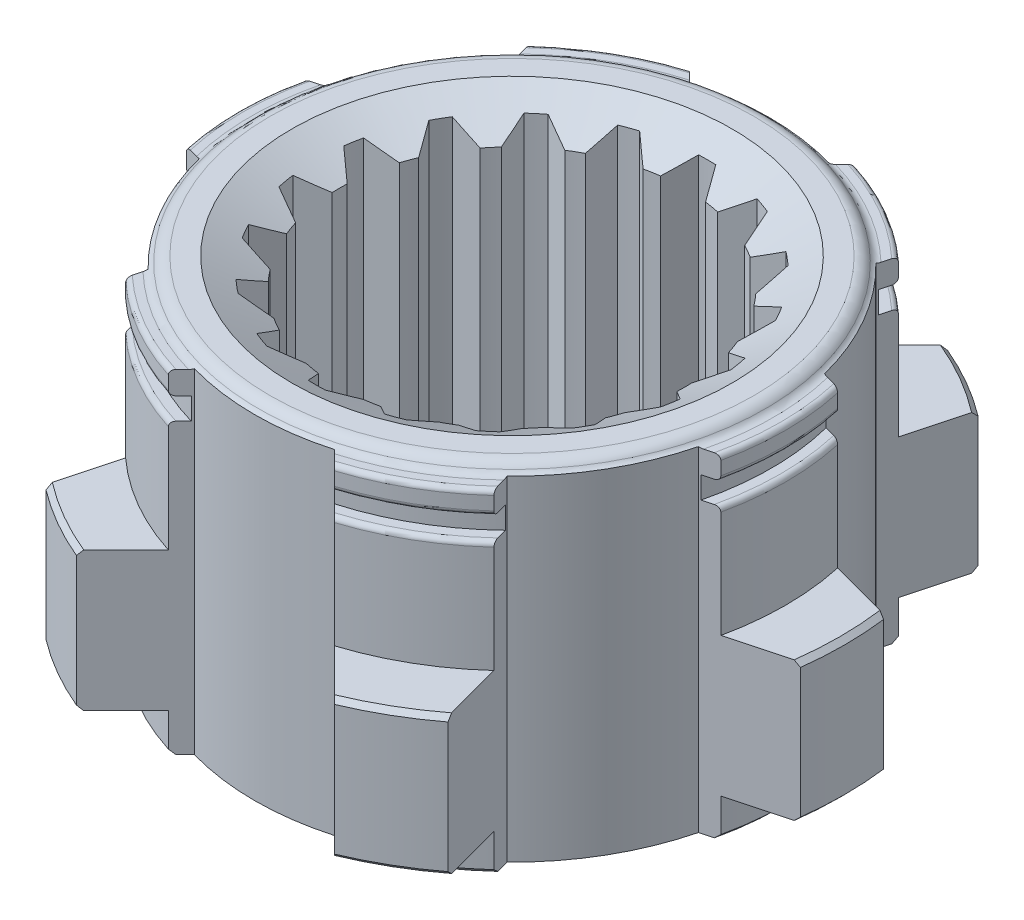
from build123d import *

# Parameters (mm, degrees)
CHANFRO1_SIZE         = 5
CHANFRO1_SIZE2        = 2.886751346
CHANFRO2_SIZE         = 5
CHANFRO2_SIZE2        = 2.886751346
FILETE1_R             = 1.5
FILETE2_R             = 1
FILETE3_R             = 0.5
CHANFRO3_SIZE         = 0.5
CORTE_EXTRUS_O1_DEPTH = 62.090261149
CORTE_EXTRUS_O2_DEPTH = 60.571494523


with BuildPart() as part:
    # Esboço1 → Revolução1 (revolve)
    with BuildSketch(Plane.XY, mode=Mode.PRIVATE) as revolu_o1_sk:
        Polygon((18.1, 26.416366366), (26.8, 26.416366366), (26.8, 25.416366366), (28.7, 25.416366366), (28.7, 23.016366366), (27.2, 23.016366366), (27.2, 20.716366366), (28.7, 20.716366366), (28.7, 9.016366366), (34.9, 9.016366366), (34.9, -5.583633634), (28.7, -5.583633634), (28.7, -9.583633634), (18.1, -9.583633634), align=None)
    revolve(revolu_o1_sk.sketch.rotate(Axis((0, -41.494294294, 0), (0, 1, 0)), 90), axis=Axis((0, -41.494294294, 0), (0, 1, 0)))

    # Chanfro1
    chanfro1_edges = [part.edges().sort_by_distance(p)[0] for p in [
        (0, 26.416366366, 18.1),
    ]]
    chanfro1_side = [part.faces().sort_by_distance(p)[0] for p in [
        (0, 26.416366366, 18.858018469),
    ]]
    chamfer(chanfro1_edges, length=CHANFRO1_SIZE, length2=CHANFRO1_SIZE2, reference=chanfro1_side[0])

    # Chanfro2
    chanfro2_edges = [part.edges().sort_by_distance(p)[0] for p in [
        (0, -9.583633634, 18.1),
    ]]
    chanfro2_side = [part.faces().sort_by_distance(p)[0] for p in [
        (0, -9.583633634, 27.888241415),
    ]]
    chamfer(chanfro2_edges, length=CHANFRO2_SIZE, length2=CHANFRO2_SIZE2, reference=chanfro2_side[0])

    # Filete1
    # the kernel refuses this fillet: 1.5 mm, written as the material it takes off along each edge
    with BuildSketch(Plane(origin=(0, 26.416366366, 0), x_dir=(0, 0, -1), z_dir=(1, 0, 0))) as filete1_piece_1:
        with BuildLine():
            CenterArc((25.385786438, -1.5), FILETE1_R, 19.471220634, 70.528779366)
            Line((26.8, -1), (26.828284271, -0.99))
            ThreePointArc((26.828284271, -0.99), (26.83, -0.5), (26.83, 0))
            Line((26.83, 0), (26.8, 0.03))
            Line((26.8, 0.03), (25.385786438, 0.03))
            Line((25.385786438, 0.03), (25.385786438, 0))
        make_face()
    revolve(axis=Axis((0, 26.416366366, 0), (0, 1, 0)), mode=Mode.SUBTRACT)

    # Filete2
    filete2_edges = [part.edges().sort_by_distance(p)[0] for p in [
        (0, 25.416366366, 26.8),
    ]]
    fillet(filete2_edges, radius=FILETE2_R)

    # Filete3
    filete3_edges = [part.edges().sort_by_distance(p)[0] for p in [
        (0, 20.716366366, 28.7),
        (0, 23.016366366, 28.7),
        (0, 25.416366366, 28.7),
    ]]
    fillet(filete3_edges, radius=FILETE3_R)

    # Chanfro3
    chanfro3_edges = [part.edges().sort_by_distance(p)[0] for p in [
        (0, -5.583633634, 34.9),
        (0, 9.016366366, 34.9),
        (0, -9.583633634, 28.7),
    ]]
    chamfer(chanfro3_edges, length=CHANFRO3_SIZE)

    # Esboço2 → Corte-extrusão1 (cut, through all)
    with BuildSketch(Plane.XZ.offset(9.583633634)):
        with BuildLine():
            Line((-7.35, -25.980329097), (-21.814074716, -40.444403813))
            Line((-21.814074716, -40.444403813), (21.814074716, -40.444403813))
            Line((21.814074716, -40.444403813), (7.35, -25.980329097))
            ThreePointArc((7.35, -25.980329097), (0, -27), (-7.35, -25.980329097))
        make_face()
        with BuildLine():
            Line((-26.174624997, -6.624877831), (-45.932918501, -1.330659043))
            Line((-45.932918501, -1.330659043), (-24.118843785, -39.11374477))
            Line((-24.118843785, -39.11374477), (-18.824624997, -19.355451266))
            ThreePointArc((-18.824624997, -19.355451266), (-23.382685902, -13.5), (-26.174624997, -6.624877831))
        make_face()
        with BuildLine():
            Line((-18.824624997, 19.355451266), (-24.118843785, 39.11374477))
            Line((-24.118843785, 39.11374477), (-45.932918501, 1.330659043))
            Line((-45.932918501, 1.330659043), (-26.174624997, 6.624877831))
            ThreePointArc((-26.174624997, 6.624877831), (-23.382685902, 13.5), (-18.824624997, 19.355451266))
        make_face()
        with BuildLine():
            Line((7.35, 25.980329097), (21.814074716, 40.444403813))
            Line((21.814074716, 40.444403813), (-21.814074716, 40.444403813))
            Line((-21.814074716, 40.444403813), (-7.35, 25.980329097))
            ThreePointArc((-7.35, 25.980329097), (0, 27), (7.35, 25.980329097))
        make_face()
        with BuildLine():
            Line((26.174624997, 6.624877831), (45.932918501, 1.330659043))
            Line((45.932918501, 1.330659043), (24.118843785, 39.11374477))
            Line((24.118843785, 39.11374477), (18.824624997, 19.355451266))
            ThreePointArc((18.824624997, 19.355451266), (23.382685902, 13.5), (26.174624997, 6.624877831))
        make_face()
        with BuildLine():
            Line((18.824624997, -19.355451266), (24.118843785, -39.11374477))
            Line((24.118843785, -39.11374477), (45.932918501, -1.330659043))
            Line((45.932918501, -1.330659043), (26.174624997, -6.624877831))
            ThreePointArc((26.174624997, -6.624877831), (23.382685902, -13.5), (18.824624997, -19.355451266))
        make_face()
    extrude(amount=-CORTE_EXTRUS_O1_DEPTH, mode=Mode.SUBTRACT)

    # Esboço3 → Corte-extrusão2 (cut, through all)
    with BuildSketch(Plane(origin=(0, 26.416366366, 0), x_dir=(1, 0, 0), z_dir=(0, 1, 0))):
        with BuildLine():
            Line((-0.9, 20.480234374), (-2.469708185, 17.761420043))
            Line((-2.469708185, 17.761420043), (2.469708185, 17.761420043))
            Line((2.469708185, 17.761420043), (0.9, 20.480234374))
            ThreePointArc((0.9, 20.480234374), (0, 20.5), (-0.9, 20.480234374))
        make_face()
        with BuildLine():
            Line((6.158929337, 19.552943242), (3.753996872, 17.534965297))
            Line((3.753996872, 17.534965297), (8.395529986, 15.845585402))
            Line((8.395529986, 15.845585402), (7.850376055, 18.937306984))
            ThreePointArc((7.850376055, 18.937306984), (7.011412938, 19.263698726), (6.158929337, 19.552943242))
        make_face()
        with BuildLine():
            Line((12.4750009, 16.267278584), (9.524914503, 15.193534947))
            Line((9.524914503, 15.193534947), (13.308726966, 12.018539305))
            Line((13.308726966, 12.018539305), (13.853880898, 15.110260887))
            ThreePointArc((13.853880898, 15.110260887), (13.177145999, 15.703911084), (12.4750009, 16.267278584))
        make_face()
        with BuildLine():
            Line((17.286403243, 11.01954005), (14.146986872, 11.01954005))
            Line((14.146986872, 11.01954005), (16.616695058, 6.741879993))
            Line((16.616695058, 6.741879993), (18.186403243, 9.460694323))
            ThreePointArc((18.186403243, 9.460694323), (17.753520778, 10.25), (17.286403243, 11.01954005))
        make_face()
        with BuildLine():
            Line((20.012810235, 4.442682355), (17.062723837, 5.516425992))
            Line((17.062723837, 5.516425992), (17.920444489, 0.652050455))
            Line((17.920444489, 0.652050455), (20.325376955, 2.670028399))
            ThreePointArc((20.325376955, 2.670028399), (20.188558937, 3.559787642), (20.012810235, 4.442682355))
        make_face()
        with BuildLine():
            Line((20.325376955, -2.670028399), (17.920444489, -0.652050455))
            Line((17.920444489, -0.652050455), (17.062723837, -5.516425992))
            Line((17.062723837, -5.516425992), (20.012810235, -4.442682355))
            ThreePointArc((20.012810235, -4.442682355), (20.188558937, -3.559787642), (20.325376955, -2.670028399))
        make_face()
        with BuildLine():
            Line((18.186403243, -9.460694323), (16.616695058, -6.741879993))
            Line((16.616695058, -6.741879993), (14.146986872, -11.01954005))
            Line((14.146986872, -11.01954005), (17.286403243, -11.01954005))
            ThreePointArc((17.286403243, -11.01954005), (17.753520778, -10.25), (18.186403243, -9.460694323))
        make_face()
        with BuildLine():
            Line((13.853880898, -15.110260887), (13.308726966, -12.018539305))
            Line((13.308726966, -12.018539305), (9.524914503, -15.193534947))
            Line((9.524914503, -15.193534947), (12.4750009, -16.267278584))
            ThreePointArc((12.4750009, -16.267278584), (13.177145999, -15.703911084), (13.853880898, -15.110260887))
        make_face()
        with BuildLine():
            Line((7.850376055, -18.937306984), (8.395529986, -15.845585402))
            Line((8.395529986, -15.845585402), (3.753996872, -17.534965297))
            Line((3.753996872, -17.534965297), (6.158929337, -19.552943242))
            ThreePointArc((6.158929337, -19.552943242), (7.011412938, -19.263698726), (7.850376055, -18.937306984))
        make_face()
        with BuildLine():
            Line((0.9, -20.480234374), (2.469708185, -17.761420043))
            Line((2.469708185, -17.761420043), (-2.469708185, -17.761420043))
            Line((-2.469708185, -17.761420043), (-0.9, -20.480234374))
            ThreePointArc((-0.9, -20.480234374), (0, -20.5), (0.9, -20.480234374))
        make_face()
        with BuildLine():
            Line((-6.158929337, -19.552943242), (-3.753996872, -17.534965297))
            Line((-3.753996872, -17.534965297), (-8.395529986, -15.845585402))
            Line((-8.395529986, -15.845585402), (-7.850376055, -18.937306984))
            ThreePointArc((-7.850376055, -18.937306984), (-7.011412938, -19.263698726), (-6.158929337, -19.552943242))
        make_face()
        with BuildLine():
            Line((-12.4750009, -16.267278584), (-9.524914503, -15.193534947))
            Line((-9.524914503, -15.193534947), (-13.308726966, -12.018539305))
            Line((-13.308726966, -12.018539305), (-13.853880898, -15.110260887))
            ThreePointArc((-13.853880898, -15.110260887), (-13.177145999, -15.703911084), (-12.4750009, -16.267278584))
        make_face()
        with BuildLine():
            Line((-17.286403243, -11.01954005), (-14.146986872, -11.01954005))
            Line((-14.146986872, -11.01954005), (-16.616695058, -6.741879993))
            Line((-16.616695058, -6.741879993), (-18.186403243, -9.460694323))
            ThreePointArc((-18.186403243, -9.460694323), (-17.753520778, -10.25), (-17.286403243, -11.01954005))
        make_face()
        with BuildLine():
            Line((-20.012810235, -4.442682355), (-17.062723837, -5.516425992))
            Line((-17.062723837, -5.516425992), (-17.920444489, -0.652050455))
            Line((-17.920444489, -0.652050455), (-20.325376955, -2.670028399))
            ThreePointArc((-20.325376955, -2.670028399), (-20.188558937, -3.559787642), (-20.012810235, -4.442682355))
        make_face()
        with BuildLine():
            Line((-20.325376955, 2.670028399), (-17.920444489, 0.652050455))
            Line((-17.920444489, 0.652050455), (-17.062723837, 5.516425992))
            Line((-17.062723837, 5.516425992), (-20.012810235, 4.442682355))
            ThreePointArc((-20.012810235, 4.442682355), (-20.188558937, 3.559787642), (-20.325376955, 2.670028399))
        make_face()
        with BuildLine():
            Line((-18.186403243, 9.460694323), (-16.616695058, 6.741879993))
            Line((-16.616695058, 6.741879993), (-14.146986872, 11.01954005))
            Line((-14.146986872, 11.01954005), (-17.286403243, 11.01954005))
            ThreePointArc((-17.286403243, 11.01954005), (-17.753520778, 10.25), (-18.186403243, 9.460694323))
        make_face()
        with BuildLine():
            Line((-13.853880898, 15.110260887), (-13.308726966, 12.018539305))
            Line((-13.308726966, 12.018539305), (-9.524914503, 15.193534947))
            Line((-9.524914503, 15.193534947), (-12.4750009, 16.267278584))
            ThreePointArc((-12.4750009, 16.267278584), (-13.177145999, 15.703911084), (-13.853880898, 15.110260887))
        make_face()
        with BuildLine():
            Line((-7.850376055, 18.937306984), (-8.395529986, 15.845585402))
            Line((-8.395529986, 15.845585402), (-3.753996872, 17.534965297))
            Line((-3.753996872, 17.534965297), (-6.158929337, 19.552943242))
            ThreePointArc((-6.158929337, 19.552943242), (-7.011412938, 19.263698726), (-7.850376055, 18.937306984))
        make_face()
    extrude(amount=-CORTE_EXTRUS_O2_DEPTH, mode=Mode.SUBTRACT)


solid = part.part
